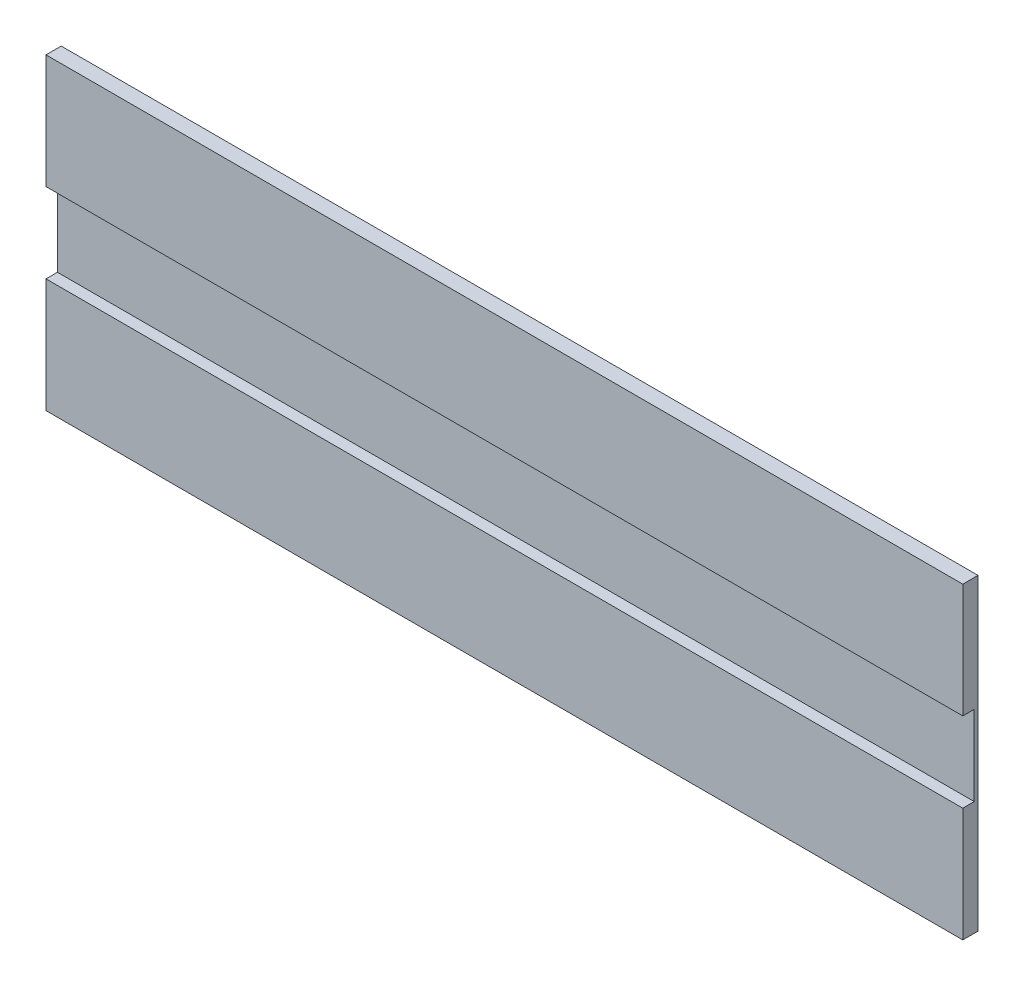
from build123d import *

# Parameters (mm, degrees)
SKIZZE1_W                       = 12050
SKIZZE1_H                       = 4050
AUFSATZ_LINEAR_AUSTRAGEN1_DEPTH = 200
SKIZZE2_W                       = 150
SKIZZE2_H                       = 1050
SCHNITT_LINEAR_AUSTRAGEN1_DEPTH = 12714.968695887


with BuildPart() as part:
    # Skizze1 → Aufsatz-Linear austragen1 (new body)
    with BuildSketch(Plane.XY):
        with Locations((6025, 2025)):
            Rectangle(SKIZZE1_W, SKIZZE1_H)
    extrude(amount=AUFSATZ_LINEAR_AUSTRAGEN1_DEPTH)

    # Skizze2 → Schnitt-Linear austragen1 (cut, through all)
    with BuildSketch(Plane(origin=(12050, 0, 0), x_dir=(0, 0, -1), z_dir=(1, 0, 0))):
        with Locations((-125, 2025)):
            Rectangle(SKIZZE2_W, SKIZZE2_H)
    extrude(amount=-SCHNITT_LINEAR_AUSTRAGEN1_DEPTH, mode=Mode.SUBTRACT)


solid = part.part
